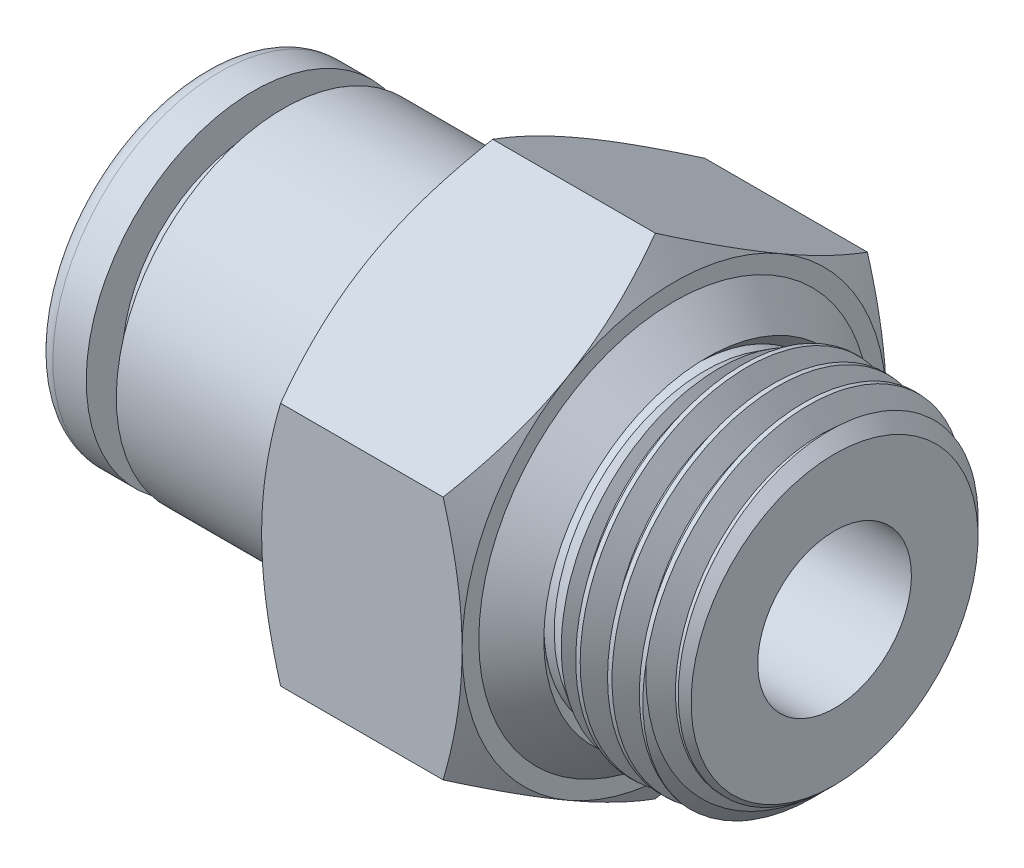
from build123d import *

# Parameters (mm, degrees)
SKETCH2_R              = 5.1435
SKETCH2_R_2            = 3.175
EXTRUDE1_DEPTH         = 4.8
EXTRUDE1_DRAFT         = 1.783333333
SKETCH5_OUTSIDE_W      = 26.658
SKETCH5_OUTSIDE_H      = 26.658
SKETCH5_OUTSIDE_R      = 4.294145567
EXTRUDE2_DEPTH         = 4.8
EXTRUDE2_DRAFT         = -45
CUT_SWEEP1_PITCH       = 0.924083939
CUT_SWEEP1_HEIGHT      = 5.723636364
CUT_SWEEP1_RADIUS      = 4.994051553
CUT_SWEEP1_START_ANGLE = -90
SKETCH7_R              = 2.3
EXTRUDE4_DEPTH         = 18.9
EXTRUDE5_START         = -6
SKETCH8_R              = 5
EXTRUDE5_DEPTH         = 6
SKETCH9_OUTSIDE_W      = 40.902
SKETCH9_OUTSIDE_H      = 42.866
SKETCH9_OUTSIDE_R      = 6.35
EXTRUDE6_DEPTH         = 6
EXTRUDE6_DRAFT         = -60
SKETCH10_OUTSIDE_W     = 40.902
SKETCH10_OUTSIDE_H     = 42.866
SKETCH10_OUTSIDE_R     = 6.35
EXTRUDE7_DEPTH         = 6
EXTRUDE7_DRAFT         = -60


# Read off the part's stored shape, not the designer's step: Extrude3
with BuildPart() as part:
    # Sketch1 → Revolve2 (revolve)
    with BuildSketch(Plane(origin=(0, 0, 0), x_dir=(-1, 0, 0), z_dir=(0, 0, -1)), mode=Mode.PRIVATE) as revolve2_sk:
        with BuildLine():
            Line((0, 4.5), (0, 3.675))
            ThreePointArc((0, 3.675), (-0.146446609, 3.321446609), (-0.5, 3.175))
            Line((-0.5, 3.175), (-13.3, 3.175))
            Line((-13.3, 3.175), (-13.3, 0))
            Line((-13.3, 0), (-18.9, 0))
            Line((-18.9, 0), (-18.9, 3.925))
            Line((-18.9, 3.925), (-14.1, 3.925))
            Line((-14.1, 3.925), (-14.1, 5))
            Line((-14.1, 5), (-2.4, 5))
            Line((-2.4, 5), (-2.4, 3.925))
            Line((-2.4, 3.925), (-1.5, 3.925))
            Line((-1.5, 3.925), (-1.5, 5))
            Line((-1.5, 5), (-0.5, 5))
            ThreePointArc((-0.5, 5), (-0.146446609, 4.853553391), (0, 4.5))
        make_face()
    revolve(revolve2_sk.sketch.rotate(Axis((0, 0, 0), (1, 0, 0)), 180), axis=Axis((0, 0, 0), (1, 0, 0)))

    # Sketch7 → Extrude4 (cut)
    with BuildSketch(Plane(origin=(18.9, 0, 0), x_dir=(0, 0, -1), z_dir=(1, 0, 0))):
        with Locations(Location((0, 0, 0), (0, 0, 90))):
            Circle(SKETCH7_R)
    extrude(amount=-EXTRUDE4_DEPTH, mode=Mode.SUBTRACT)

    # Sketch8 → Extrude5 (add)
    with BuildSketch(Plane(origin=(14.1, 0, 0), x_dir=(0, 0, -1), z_dir=(1, 0, 0)).offset(EXTRUDE5_START)):
        Polygon((0, 7.332348419), (-6.35, 3.666174209), (-6.35, -3.666174209), (0, -7.332348419), (6.35, -3.666174209), (6.35, 3.666174209), align=None)
        with Locations(Location((0, 0, 0), (0, 0, 270))):
            Circle(SKETCH8_R, mode=Mode.SUBTRACT)
    extrude(amount=EXTRUDE5_DEPTH)


with BuildPart() as body_2:
    # Sketch2 → Extrude1 (with draft: the straight prism first)
    with BuildSketch(Plane(origin=(14.1, 0, 0), x_dir=(0, 0, -1), z_dir=(1, 0, 0))):
        Circle(SKETCH2_R)
        with Locations(Location((0, 0, 0), (0, 0, 270))):
            Circle(SKETCH2_R_2, mode=Mode.SUBTRACT)
    extrude(amount=EXTRUDE1_DEPTH)
    # Extrude1: the draft: its side faces are tilted about the plane it starts from
    extrude1_sides = [body_2.faces().sort_by_distance(p)[0] for p in [
        (16.5, 0, 5.1435),
        (16.5, 3.175, 0),
    ]]
    draft(extrude1_sides, Plane(origin=(14.1, 0, 0), x_dir=(0, 0, -1), z_dir=(1, 0, 0)), EXTRUDE1_DRAFT)


with BuildPart() as extrude2_tool:
    # Sketch5 outside → Extrude2 (with draft: the straight prism first)
    with BuildSketch(Plane(origin=(18.9, 0, 0), x_dir=(0, 0, -1), z_dir=(1, 0, 0))):
        Rectangle(SKETCH5_OUTSIDE_W, SKETCH5_OUTSIDE_H)
        Circle(SKETCH5_OUTSIDE_R, mode=Mode.SUBTRACT)
    extrude(amount=-EXTRUDE2_DEPTH)
    # Extrude2: the draft: its side faces are tilted about the plane it starts from
    extrude2_sides = [extrude2_tool.faces().sort_by_distance(p)[0] for p in [
        (16.5, -13.329, 0),
        (16.5, 0, -13.329),
        (16.5, 13.329, 0),
        (16.5, 0, 13.329),
        (16.5, 0, 4.294145567),
    ]]
    draft(extrude2_sides, Plane(origin=(18.9, 0, 0), x_dir=(0, 0, -1), z_dir=(1, 0, 0)), EXTRUDE2_DRAFT)


with BuildPart() as body_2_1:
    add(body_2.part)

    # Extrude2: cut by extrude2_tool
    add(extrude2_tool.part, mode=Mode.SUBTRACT)

    # Cut-Sweep1: sweep along a helix
    with BuildLine() as cut_sweep1_path:
        # a taper helix: rise per turn along the axis 0.923636364, along the cone's slant (build123d's pitch) 0.924083939
        add(Helix(CUT_SWEEP1_PITCH, CUT_SWEEP1_HEIGHT, CUT_SWEEP1_RADIUS, center=(18.9, 0, 0), direction=(-1, 0, 0), cone_angle=1.783333333, mode=Mode.PRIVATE).rotate(Axis((18.9, 0, 0), (-1, 0, 0)), CUT_SWEEP1_START_ANGLE))
    # Sketch4 → Cut-Sweep1 (sweep, cut)
    with BuildSketch(Plane(origin=(0, 0, 0), x_dir=(-1, 0, 0), z_dir=(0, 0, -1))):
        Polygon((-19.361818182, 4.394132137), (-19.246363636, 4.394132137), (-18.842272727, 5.094038122), (-19.708181818, 4.994051553), align=None)
    sweep(path=cut_sweep1_path.line, is_frenet=True, mode=Mode.SUBTRACT)

    # Sketch5.5 → Cut-Revolve1 (revolve, cut)
    with BuildSketch(Plane.XY, mode=Mode.PRIVATE) as cut_revolve1_sk:
        Polygon((14.1, -5.1435), (15.023189005, -5.114756424), (15.94637801, -5.086012849), (15.023189005, -4.514837008), (14.1, -4.543580584), align=None)
    revolve(cut_revolve1_sk.sketch.rotate(Axis((14.1, 0, 0), (1, 0, 0)), 90), axis=Axis((14.1, 0, 0), (1, 0, 0)), mode=Mode.SUBTRACT)

    # Extrude3 outline → Extrude3 (revolve)
    with BuildSketch(Plane.YX):
        Polygon((4.52430179, 14.71919821), (4.52430179, 14.1), (5.1435, 14.1), align=None)
    revolve(axis=Axis((0, 0, 0), (1, 0, 0)))


with BuildPart() as extrude6_tool:
    # Sketch9 outside → Extrude6 (with draft: the straight prism first)
    with BuildSketch(Plane(origin=(14.1, 0, 0), x_dir=(0, 0, -1), z_dir=(1, 0, 0))):
        Rectangle(SKETCH9_OUTSIDE_W, SKETCH9_OUTSIDE_H)
        Circle(SKETCH9_OUTSIDE_R, mode=Mode.SUBTRACT)
    extrude(amount=-EXTRUDE6_DEPTH)
    # Extrude6: the draft: its side faces are tilted about the plane it starts from
    extrude6_sides = [extrude6_tool.faces().sort_by_distance(p)[0] for p in [
        (11.1, -21.433, 0),
        (11.1, 0, -20.451),
        (11.1, 21.433, 0),
        (11.1, 0, 20.451),
        (11.1, 0, 6.35),
    ]]
    draft(extrude6_sides, Plane(origin=(14.1, 0, 0), x_dir=(0, 0, -1), z_dir=(1, 0, 0)), EXTRUDE6_DRAFT)


with BuildPart() as part_1:
    add(part.part)

    # Extrude6: cut by extrude6_tool
    add(extrude6_tool.part, mode=Mode.SUBTRACT)


with BuildPart() as extrude7_tool:
    # Sketch10 outside → Extrude7 (with draft: the straight prism first)
    with BuildSketch(Plane.ZY.offset(-8.1)):
        Rectangle(SKETCH10_OUTSIDE_W, SKETCH10_OUTSIDE_H)
        Circle(SKETCH10_OUTSIDE_R, mode=Mode.SUBTRACT)
    extrude(amount=-EXTRUDE7_DEPTH)
    # Extrude7: the draft: its side faces are tilted about the plane it starts from
    extrude7_sides = [extrude7_tool.faces().sort_by_distance(p)[0] for p in [
        (11.1, -21.433, 0),
        (11.1, 0, 20.451),
        (11.1, 21.433, 0),
        (11.1, 0, -20.451),
        (11.1, 0, -6.35),
    ]]
    draft(extrude7_sides, Plane.ZY.offset(-8.1), EXTRUDE7_DRAFT)


with BuildPart() as part_2:
    add(part_1.part)

    # Extrude7: cut by extrude7_tool
    add(extrude7_tool.part, mode=Mode.SUBTRACT)


with BuildPart() as body_2_2:
    add(body_2_1.part)

    # Combine1: union part
    add(part_2.part)


with BuildPart() as body_2_2_1:
    # Sketch12 → Revolve3 (revolve)
    with BuildSketch(Plane.XY, mode=Mode.PRIVATE) as revolve3_sk:
        Polygon((14.1, 5.850606781), (15.072751601, 4.877855181), (14.71919821, 4.52430179), (14.1, 5.1435), align=None)
    revolve(revolve3_sk.sketch.rotate(Axis((0, 0, 0), (1, 0, 0)), 90), axis=Axis((0, 0, 0), (1, 0, 0)))


solid = Compound([body_2_2.part, body_2_2_1.part])
